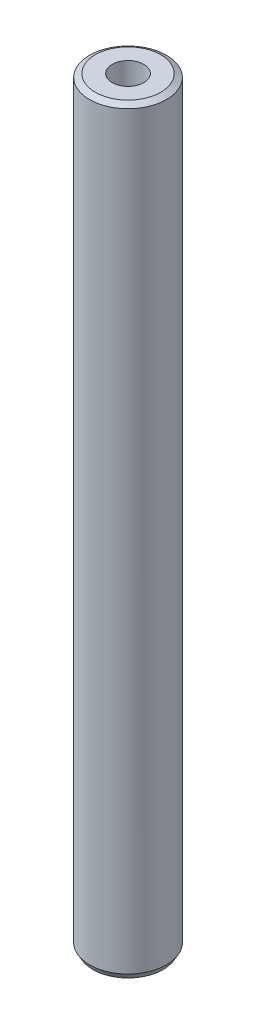
from build123d import *
from OCP.BRepFilletAPI import BRepFilletAPI_MakeChamfer

# Parameters (mm, degrees)
SKETCH1_R           = 25
BOSS_EXTRUDE1_DEPTH = 493.208778863
SKETCH2_R           = 10.293810333
CUT_EXTRUDE1_DEPTH  = 495.474366927
CHAMFER1_SIZE       = 2.181452868
CHAMFER1_SIZE2      = 3.778387201


with BuildPart() as part:
    # Sketch1 → Boss-Extrude1 (new body)
    with BuildSketch(Plane(origin=(0, 0, 0), x_dir=(1, 0, 0), z_dir=(0, 1, 0))):
        Circle(SKETCH1_R)
    extrude(amount=BOSS_EXTRUDE1_DEPTH)

    # Sketch2 → Cut-Extrude1 (cut, through all)
    with BuildSketch(Plane(origin=(0, 0, 0), x_dir=(1, 0, 0), z_dir=(0, 1, 0))):
        Circle(SKETCH2_R)
    extrude(amount=CUT_EXTRUDE1_DEPTH, mode=Mode.SUBTRACT)

    # Chamfer1: one chamfer whose edges measure the first distance from different faces: ONE call of the kernel's chamfer builder (chamfer() names one face for all edges)
    chamfer1_edges_1 = [part.edges().sort_by_distance(p)[0] for p in [
        (-25, 493.208778863, 0),
    ]]
    chamfer1_side_1 = [part.faces().sort_by_distance(p)[0] for p in [
        (-25, 246.604389432, 0),
    ]]
    chamfer1_edges_2 = [part.edges().sort_by_distance(p)[0] for p in [
        (-25, 0, 0),
    ]]
    chamfer1_side_2 = [part.faces().sort_by_distance(p)[0] for p in [
        (-24.292893219, 0, 0),
    ]]
    chamfer1 = BRepFilletAPI_MakeChamfer(part.part.solid().wrapped)
    for e in chamfer1_edges_1:
        chamfer1.Add(CHAMFER1_SIZE, CHAMFER1_SIZE2, e.wrapped, chamfer1_side_1[0].wrapped)  # the first distance lies on this face
    for e in chamfer1_edges_2:
        chamfer1.Add(CHAMFER1_SIZE, CHAMFER1_SIZE2, e.wrapped, chamfer1_side_2[0].wrapped)  # the first distance lies on this face
    add(Compound.cast(chamfer1.Shape()), mode=Mode.REPLACE)


solid = part.part
